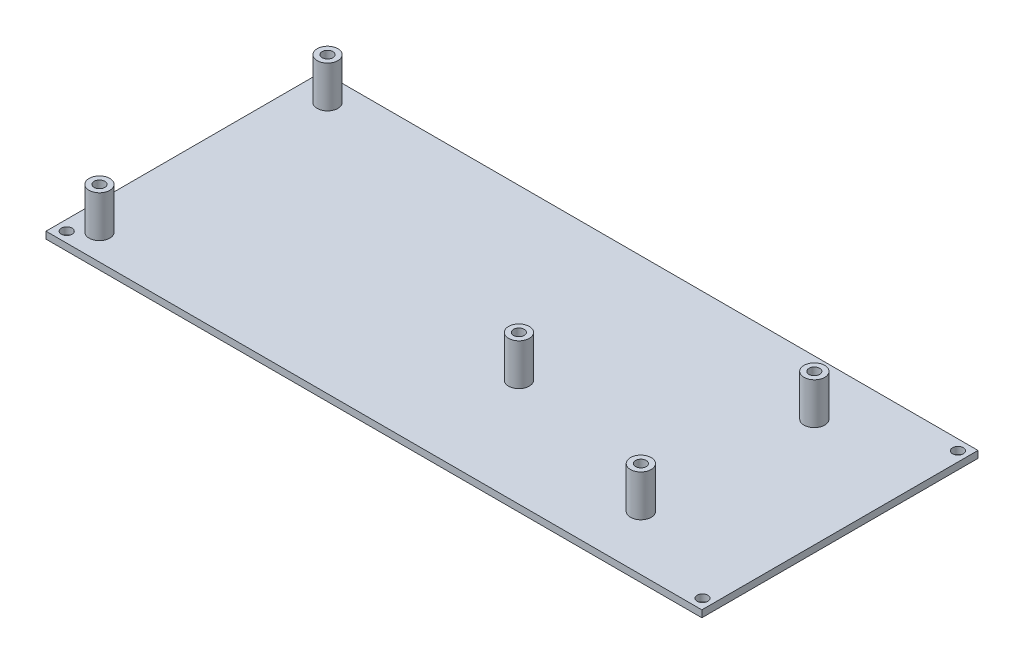
from build123d import *

# Parameters (mm, degrees)
SKETCH1_W           = 190
SKETCH1_H           = 80
SKETCH1_R           = 1.55
BOSS_EXTRUDE1_DEPTH = 2
SKETCH2_R           = 3
SKETCH2_R_2         = 1.55
BOSS_EXTRUDE2_DEPTH = 12


with BuildPart() as part:
    # Sketch1 → Boss-Extrude1 (new body)
    with BuildSketch(Plane(origin=(0, 0, 0), x_dir=(1, 0, 0), z_dir=(0, 1, 0))):
        with Locations((19.251207729, 0.579710145)):
            Rectangle(SKETCH1_W, SKETCH1_H)
        with Locations((-72.748792271, 37.579710145)):
            Circle(SKETCH1_R, mode=Mode.SUBTRACT)
        with Locations((111.435917928, 37.579710145)):
            Circle(SKETCH1_R, mode=Mode.SUBTRACT)
        with Locations((111.435917928, -36.420289855)):
            Circle(SKETCH1_R, mode=Mode.SUBTRACT)
        with Locations((-72.748792271, -36.420289855)):
            Circle(SKETCH1_R, mode=Mode.SUBTRACT)
    extrude(amount=BOSS_EXTRUDE1_DEPTH)

    # Sketch2 → Boss-Extrude2 (add)
    # profile 1 of 5: a face of its own
    with BuildSketch(Plane(origin=(0, 2, 0), x_dir=(1, 0, 0), z_dir=(0, 1, 0))):
        with Locations((82.711207729, 24.709710145)):
            Circle(SKETCH2_R)
        with Locations((82.711207729, 24.709710145)):
            Circle(SKETCH2_R_2, mode=Mode.SUBTRACT)
    # profile 2 of 5: a face of its own
    with BuildSketch(Plane(origin=(0, 2, 0), x_dir=(1, 0, 0), z_dir=(0, 1, 0))):
        with Locations((80.711207729, -23.550289855)):
            Circle(SKETCH2_R)
        with Locations((80.711207729, -23.550289855)):
            Circle(SKETCH2_R_2, mode=Mode.SUBTRACT)
    # profile 3 of 5: a face of its own
    with BuildSketch(Plane(origin=(0, 2, 0), x_dir=(1, 0, 0), z_dir=(0, 1, 0))):
        with Locations((30.141207729, -8.310289855)):
            Circle(SKETCH2_R)
        with Locations((30.141207729, -8.310289855)):
            Circle(SKETCH2_R_2, mode=Mode.SUBTRACT)
    # profile 4 of 5: a face of its own
    with BuildSketch(Plane(origin=(0, 2, 0), x_dir=(1, 0, 0), z_dir=(0, 1, 0))):
        with Locations((-67.258792271, 33.649710145)):
            Circle(SKETCH2_R)
        with Locations((-67.258792271, 33.649710145)):
            Circle(SKETCH2_R_2, mode=Mode.SUBTRACT)
    # profile 5 of 5: a face of its own
    with BuildSketch(Plane(origin=(0, 2, 0), x_dir=(1, 0, 0), z_dir=(0, 1, 0))):
        with Locations((-67.748792271, -31.930289855)):
            Circle(SKETCH2_R)
        with Locations((-67.748792271, -31.930289855)):
            Circle(SKETCH2_R_2, mode=Mode.SUBTRACT)
    extrude(amount=BOSS_EXTRUDE2_DEPTH)


solid = part.part
